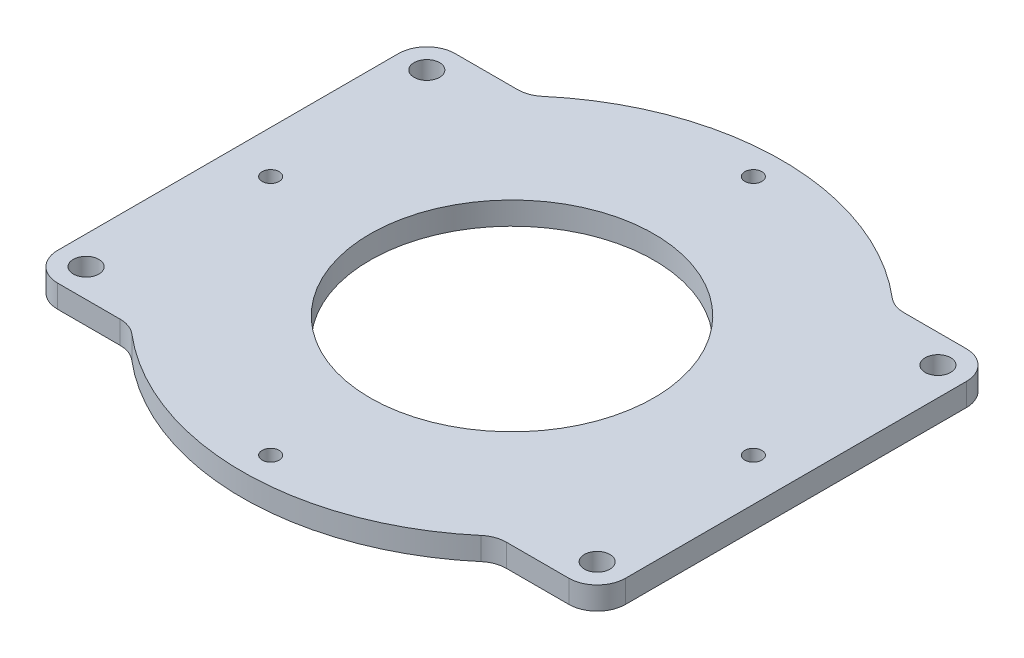
from build123d import *

# Parameters (mm, degrees)
SKETCH1_R           = 2.25
SKETCH1_R_2         = 25
SKETCH1_R_3         = 1.5
BOSS_EXTRUDE1_DEPTH = 4


with BuildPart() as part:
    # Sketch1 → Boss-Extrude1 (new body)
    with BuildSketch(Plane(origin=(0, 0, 0), x_dir=(1, 0, 0), z_dir=(0, 1, 0))):
        with BuildLine():
            Line((50, -30), (50, 30))
            ThreePointArc((50, 30), (48.535533906, 33.535533906), (45, 35))
            Line((45, 35), (34.003676272, 35))
            ThreePointArc((34.003676272, 35), (32.278512373, 35.307046823), (30.765230913, 36.19047619))
            ThreePointArc((30.765230913, 36.19047619), (0, 47.5), (-30.765230913, 36.19047619))
            ThreePointArc((-30.765230913, 36.19047619), (-32.278512373, 35.307046823), (-34.003676272, 35))
            Line((-34.003676272, 35), (-45, 35))
            ThreePointArc((-45, 35), (-48.535533906, 33.535533906), (-50, 30))
            Line((-50, 30), (-50, -30))
            ThreePointArc((-50, -30), (-48.535533906, -33.535533906), (-45, -35))
            Line((-45, -35), (-34.003676272, -35))
            ThreePointArc((-34.003676272, -35), (-32.278512373, -35.307046823), (-30.765230913, -36.19047619))
            ThreePointArc((-30.765230913, -36.19047619), (0, -47.5), (30.765230913, -36.19047619))
            ThreePointArc((30.765230913, -36.19047619), (32.278512373, -35.307046823), (34.003676272, -35))
            Line((34.003676272, -35), (45, -35))
            ThreePointArc((45, -35), (48.535533906, -33.535533906), (50, -30))
        make_face()
        with Locations((-45, 30)):
            Circle(SKETCH1_R, mode=Mode.SUBTRACT)
        with Locations((-45, -30)):
            Circle(SKETCH1_R, mode=Mode.SUBTRACT)
        with Locations((45, -30)):
            Circle(SKETCH1_R, mode=Mode.SUBTRACT)
        with Locations((45, 30)):
            Circle(SKETCH1_R, mode=Mode.SUBTRACT)
        Circle(SKETCH1_R_2, mode=Mode.SUBTRACT)
        with Locations((0, 42.5)):
            Circle(SKETCH1_R_3, mode=Mode.SUBTRACT)
        with Locations((42.5, 0)):
            Circle(SKETCH1_R_3, mode=Mode.SUBTRACT)
        with Locations((0, -42.5)):
            Circle(SKETCH1_R_3, mode=Mode.SUBTRACT)
        with Locations((-42.5, 0)):
            Circle(SKETCH1_R_3, mode=Mode.SUBTRACT)
    extrude(amount=BOSS_EXTRUDE1_DEPTH)


solid = part.part
